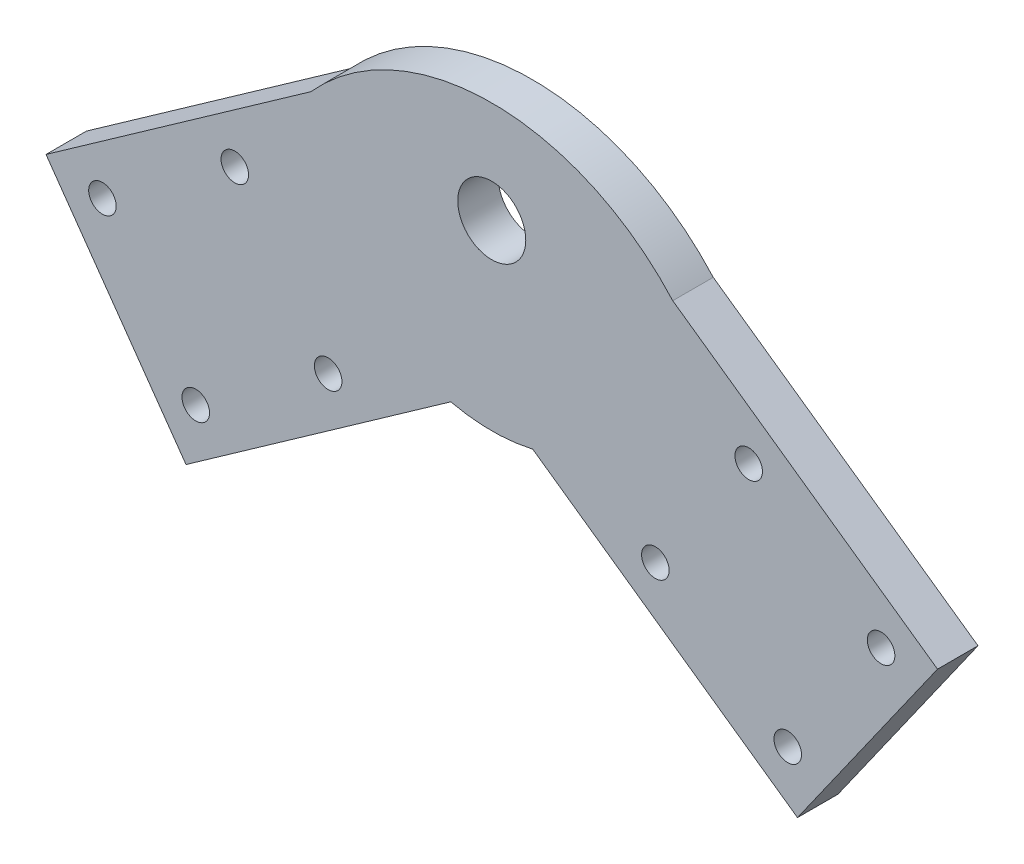
from build123d import *

# Parameters (mm, degrees)
SKETCH2_R            = 4.2
BOSS_EXTRUDE1_DEPTH  = 5
M3_CLEARANCE_HOLE1_D = 3.4


with BuildPart() as part:
    # Sketch2 → Boss-Extrude1 (new body)
    with BuildSketch(Plane.XY):
        with BuildLine():
            ThreePointArc((-5.061398723, -21.923326458), (0, -22.5), (5.061398723, -21.923326458))
            Line((5.061398723, -21.923326458), (37.751345105, -44.974734343))
            Line((37.751345105, -44.974734343), (55.039901019, -20.457274556))
            Line((55.039901019, -20.457274556), (22.349954637, 2.594133329))
            ThreePointArc((22.349954637, 2.594133329), (0, 12.582148727), (-22.349954637, 2.594133329))
            Line((-22.349954637, 2.594133329), (-55.039901019, -20.457274556))
            Line((-55.039901019, -20.457274556), (-37.751345105, -44.974734343))
            Line((-37.751345105, -44.974734343), (-5.061398723, -21.923326458))
        make_face()
        Circle(SKETCH2_R, mode=Mode.SUBTRACT)
    extrude(amount=BOSS_EXTRUDE1_DEPTH)

    # M3 Clearance Hole1 (through all)
    with Locations(Plane.XY.offset(5)):
        with Locations((-31.727258545, -10.136387926), (-20.201554602, -26.481361117), (-36.546527793, -38.00706506), (-48.072231736, -21.662091868), (31.727258545, -10.136387926), (48.072231736, -21.662091868), (20.201554544, -26.481361199), (36.546527736, -38.007065141)):
            Hole(M3_CLEARANCE_HOLE1_D / 2)


solid = part.part
